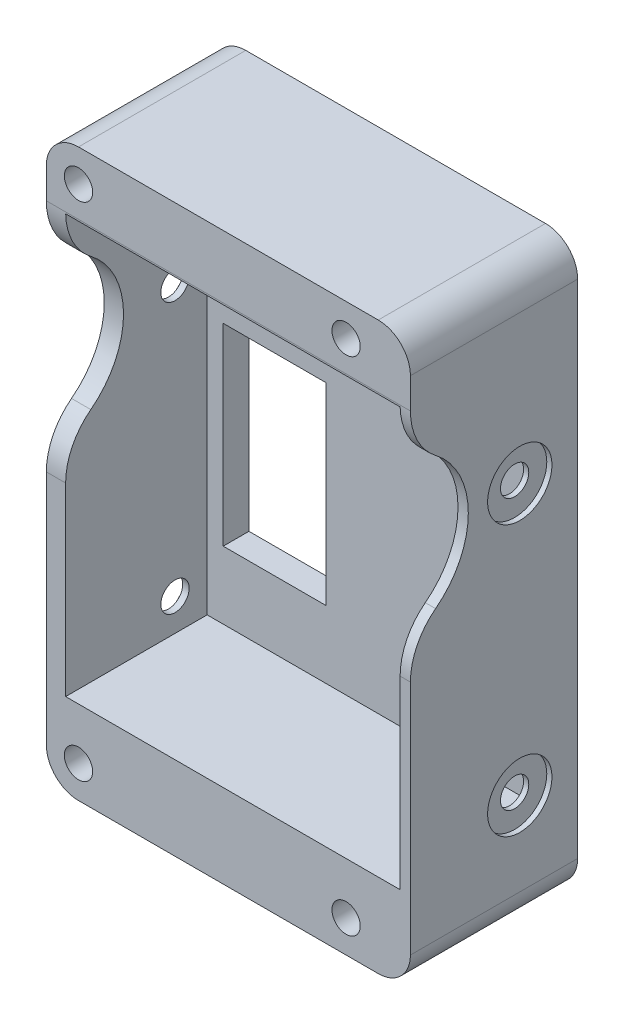
from build123d import *
from build123d.topology import SkipClean

# Parameters (mm, degrees)
SKETCH_1_R          = 1.1
SKETCH_1_W          = 26
SKETCH_1_H          = 32.5
EXTRUDE_1_DEPTH     = 11
EXTRUDE_START       = 2
SKETCH_3_R          = 1.1
EXTRUDE_2_DEPTH     = 2
SKETCH_2_R          = 1.1
CUT_EXTRUDE_1_DEPTH = 49.250803102
SKETCH_4_W          = 8
SKETCH_4_H          = 15
CUT_EXTRUDE_3_DEPTH = 10
SKETCH_5_R          = 6.5
CUT_EXTRUDE_4_DEPTH = 49.250803102
FILLET_START        = -2
FILLET_1_DEPTH      = 30
SKETCH_6_R          = 2.5
CUT_EXTRUDE_5_DEPTH = 0.4
CUT_EXTRUDE_START   = -1
SKETCH_7_R          = 2.5
CUT_EXTRUDE_6_DEPTH = 1


with BuildPart() as part:
    # ｽｹｯﾁ1 → ﾎﾞｽ - 押し出し1 (new body)
    with BuildSketch(Plane.XY):
        with BuildLine():
            Line((26.8, 35), (26.8, -4))
            ThreePointArc((26.8, -4), (26.067766953, -5.767766953), (24.3, -6.5))
            Line((24.3, -6.5), (1, -6.5))
            ThreePointArc((1, -6.5), (-0.767766953, -5.767766953), (-1.5, -4))
            Line((-1.5, -4), (-1.5, 35))
            ThreePointArc((-1.5, 35), (-0.767766953, 36.767766953), (1, 37.5))
            Line((1, 37.5), (24.3, 37.5))
            ThreePointArc((24.3, 37.5), (26.067766953, 36.767766953), (26.8, 35))
        make_face()
        with Locations((21.8, 35)):
            Circle(SKETCH_1_R, mode=Mode.SUBTRACT)
        with Locations((1, 35)):
            Circle(SKETCH_1_R, mode=Mode.SUBTRACT)
        with Locations((1, -4)):
            Circle(SKETCH_1_R, mode=Mode.SUBTRACT)
        with Locations((21.8, -4)):
            Circle(SKETCH_1_R, mode=Mode.SUBTRACT)
        with Locations((13, 16.25)):
            Rectangle(SKETCH_1_W, SKETCH_1_H, mode=Mode.SUBTRACT)
    extrude(amount=EXTRUDE_1_DEPTH)

    # ｽｹｯﾁ3 → ﾎﾞｽ - 押し出し2 (add)
    with SkipClean():  # the faces are left unmerged after this step: merging them gives an invalid solid
        with BuildSketch(Plane(origin=(0, 0, 0), x_dir=(-1, 0, 0), z_dir=(0, 0, -1)).offset(EXTRUDE_START)):
            with BuildLine():
                Line((1.5, -4), (1.5, 35))
                ThreePointArc((1.5, 35), (0.767766953, 36.767766953), (-1, 37.5))
                Line((-1, 37.5), (-24.3, 37.5))
                ThreePointArc((-24.3, 37.5), (-26.067766953, 36.767766953), (-26.8, 35))
                Line((-26.8, 35), (-26.8, -4))
                ThreePointArc((-26.8, -4), (-26.067766953, -5.767766953), (-24.3, -6.5))
                Line((-24.3, -6.5), (-1, -6.5))
                ThreePointArc((-1, -6.5), (0.767766953, -5.767766953), (1.5, -4))
            make_face()
            with Locations((-21.8, -4)):
                Circle(SKETCH_3_R, mode=Mode.SUBTRACT)
            with Locations((-1, -4)):
                Circle(SKETCH_3_R, mode=Mode.SUBTRACT)
            with Locations((-1, 35)):
                Circle(SKETCH_3_R, mode=Mode.SUBTRACT)
            with Locations((-21.8, 35)):
                Circle(SKETCH_3_R, mode=Mode.SUBTRACT)
        extrude(amount=-EXTRUDE_2_DEPTH)

    # ｽｹｯﾁ2 → ｶｯﾄ - 押し出し1 (cut, through all)
    with SkipClean():  # the faces are left unmerged after this step: merging them gives an invalid solid
        with BuildSketch(Plane.ZY.offset(1.5)):
            with Locations(Location((2.5, 23.5, 0), (0, 0, 270))):
                Circle(SKETCH_2_R)
            with Locations(Location((2.5, 2.5, 0), (0, 0, 270))):
                Circle(SKETCH_2_R)
        extrude(amount=-CUT_EXTRUDE_1_DEPTH, mode=Mode.SUBTRACT)

    # ｽｹｯﾁ4 → ｶｯﾄ - 押し出し3 (cut)
    with SkipClean():  # the faces are left unmerged after this step: merging them gives an invalid solid
        with BuildSketch(Plane(origin=(0, 0, -2), x_dir=(-1, 0, 0), z_dir=(0, 0, -1))):
            with Locations((-5.25, 12.75)):
                Rectangle(SKETCH_4_W, SKETCH_4_H)
        extrude(amount=-CUT_EXTRUDE_3_DEPTH, mode=Mode.SUBTRACT)

    # ｽｹｯﾁ5 → ｶｯﾄ - 押し出し4 (cut, through all)
    with SkipClean():  # the faces are left unmerged after this step: merging them gives an invalid solid
        with BuildSketch(Plane(origin=(26.8, 0, 0), x_dir=(0, 0, -1), z_dir=(1, 0, 0))):
            with Locations((-13, 23.5)):
                Circle(SKETCH_5_R)
        extrude(amount=-CUT_EXTRUDE_4_DEPTH, mode=Mode.SUBTRACT)

    # ﾌｨﾚｯﾄ1: read off the stored shape, not the designer's step
    # ﾌｨﾚｯﾄ1 outline → ﾌｨﾚｯﾄ1 (cut)
    with SkipClean():  # the faces are left unmerged after this step: merging them gives an invalid solid
        with BuildSketch(Plane.YZ.offset(FILLET_START)):
            with BuildLine():
                ThreePointArc((14.375856205, 11), (16.587485547, 10.484272031), (18.342875246, 9.043478261))
                ThreePointArc((18.342875246, 9.043478261), (17.745349201, 9.977750147), (17.315341562, 11))
                Line((17.315341562, 11), (14.375856205, 11))
            make_face()
            with BuildLine():
                ThreePointArc((29.684658438, 11), (29.254650799, 9.977750147), (28.657124754, 9.043478261))
                ThreePointArc((28.657124754, 9.043478261), (30.412514453, 10.484272031), (32.624143795, 11))
                Line((32.624143795, 11), (29.684658438, 11))
            make_face()
        extrude(amount=FILLET_1_DEPTH, mode=Mode.SUBTRACT)

    # ｽｹｯﾁ6 → ｶｯﾄ - 押し出し5 (cut)
    with SkipClean():  # the faces are left unmerged after this step: merging them gives an invalid solid
        with BuildSketch(Plane(origin=(26.8, 0, 0), x_dir=(0, 0, -1), z_dir=(1, 0, 0))):
            with Locations((-2.5, 2.5)):
                Circle(SKETCH_6_R)
            with Locations((-2.5, 23.5)):
                Circle(SKETCH_6_R)
        extrude(amount=-CUT_EXTRUDE_5_DEPTH, mode=Mode.SUBTRACT)

    # ｽｹｯﾁ7 → ｶｯﾄ - 押し出し6 (cut)
    with SkipClean():  # the faces are left unmerged after this step: merging them gives an invalid solid
        with BuildSketch(Plane.ZY.offset(1.5).offset(CUT_EXTRUDE_START)):
            with Locations(Location((2.5, 2.5, 0), (0, 0, 180))):
                Circle(SKETCH_7_R)
            with Locations(Location((2.5, 23.5, 0), (0, 0, 180))):
                Circle(SKETCH_7_R)
        extrude(amount=CUT_EXTRUDE_6_DEPTH, mode=Mode.SUBTRACT)


solid = part.part
